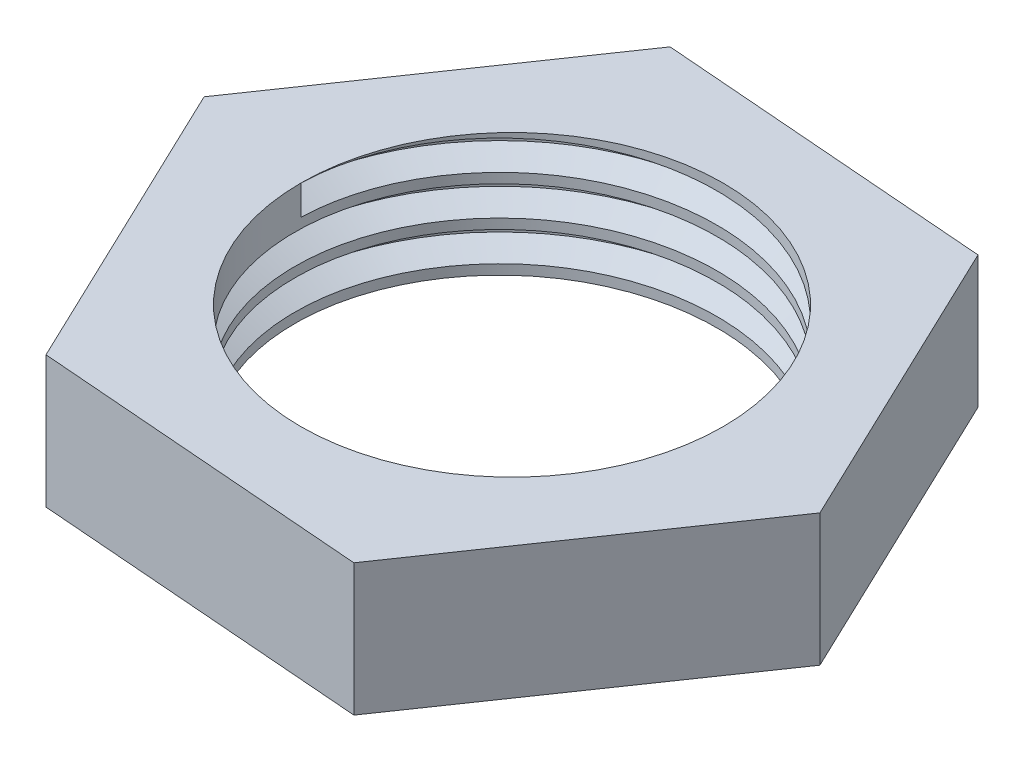
from build123d import *

# Parameters (mm, degrees)
SKETCH1_R           = 8
BOSS_EXTRUDE1_DEPTH = 5
THREAD1_PITCH       = 1.5


with BuildPart() as part:
    # Sketch1 → Boss-Extrude1 (new body)
    with BuildSketch(Plane(origin=(0, 0, 0), x_dir=(1, 0, 0), z_dir=(0, 1, 0))):
        Polygon((7.191830325, 10.469522907), (-5.47095764, 11.463069215), (-12.662787966, 0.993546308), (-7.191830325, -10.469522907), (5.47095764, -11.463069215), (12.662787966, -0.993546308), align=None)
        with Locations(Location((0, 0, 0), (0, 0, 270))):
            Circle(SKETCH1_R, mode=Mode.SUBTRACT)
    extrude(amount=BOSS_EXTRUDE1_DEPTH)

    # Thread1: the profile of Thread Profile1 profile screwed along a right-hand helix of 3.333333 turns, 8 arcs to a turn; built about Z, then put on its axis
    thread1_z = Axis((0, 0, 0), (0, 0, 1))
    thread1_corners = [(7.9997, 0, -0.000173205), (8.811898813, 0, 0.468749998), (8.811898813, 0, 0.656249998), (7.9997, 0, 1.125173201)]
    with BuildLine(mode=Mode.PRIVATE) as thread1_profile:
        Line(thread1_corners[0], thread1_corners[1])
        Line(thread1_corners[1], thread1_corners[2])
        Line(thread1_corners[2], thread1_corners[3])
        Line(thread1_corners[3], thread1_corners[0])
    thread1_cap = Face(thread1_profile.wire())
    thread1_turn_angles = [0, 22.5, 45, 67.5, 90, 112.5, 135, 157.5, 180, 202.5, 225, 247.5, 270, 292.5, 315, 337.5, 360]
    thread1_turn_weights = [1, 0.9238795325112867, 1, 0.9238795325112867, 1, 0.9238795325112867, 1, 0.9238795325112867, 1, 0.9238795325112867, 1, 0.9238795325112867, 1, 0.9238795325112867, 1, 0.9238795325112867, 1]
    thread1_turn_rails = [Edge.make_bspline([Vector(p[0], p[1], 0).rotate(thread1_z, thread1_turn_angles[k]) / thread1_turn_weights[k] + Vector(0, 0, p[2] + THREAD1_PITCH * thread1_turn_angles[k] / 360) for k in range(17)], [0, 0, 0, 1, 1, 2, 2, 3, 3, 4, 4, 5, 5, 6, 6, 7, 7, 8, 8, 8], 2, thread1_turn_weights) for p in thread1_corners]
    thread1_turn_sides = [Face.make_surface_from_curves(thread1_turn_rails[p[0]], thread1_turn_rails[p[1]]) for p in [(0, 1), (1, 2), (2, 3), (3, 0)]]
    thread1_last_angles = [1080, 1102.5, 1125, 1147.5, 1170, 1185, 1200]
    thread1_last_weights = [1, 0.9238795325112867, 1, 0.9238795325112867, 1, 0.9659258262890688, 1]
    thread1_last_rails = [Edge.make_bspline([Vector(p[0], p[1], 0).rotate(thread1_z, thread1_last_angles[k]) / thread1_last_weights[k] + Vector(0, 0, p[2] + THREAD1_PITCH * thread1_last_angles[k] / 360) for k in range(7)], [0, 0, 0, 1, 1, 2, 2, 3, 3, 3], 2, thread1_last_weights) for p in thread1_corners]
    thread1_last_sides = [Face.make_surface_from_curves(thread1_last_rails[p[0]], thread1_last_rails[p[1]]) for p in [(0, 1), (1, 2), (2, 3), (3, 0)]]
    thread1 = Plane(origin=(0, 5, 0), x_dir=(-1, 0, 0), z_dir=(0, -1, 0)) * Solid(Shell([*[p.moved(Location((0, 0, THREAD1_PITCH * i))) for i in range(3) for p in thread1_turn_sides], *thread1_last_sides, thread1_cap, thread1_cap.rotate(thread1_z, 1200).moved(Location((0, 0, THREAD1_PITCH * 1200 / 360)))]))
    add(thread1, mode=Mode.SUBTRACT)


solid = part.part
